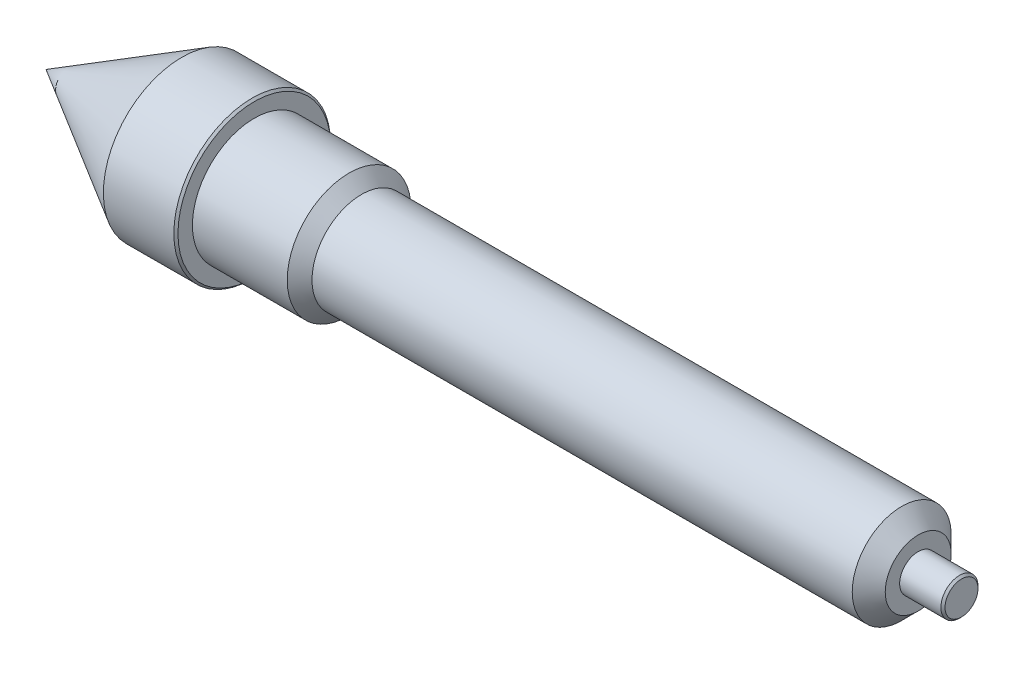
from build123d import *

# Parameters (mm, degrees)
SZKIC5_R                    = 4.5
DODANIE_WYCI_GNI_CIE4_DEPTH = 10.5
SFAZOWANIE1_SIZE            = 0.5
SZKIC6_R                    = 12
DODANIE_WYCI_GNI_CIE5_DEPTH = 135
SFAZOWANIE2_SIZE            = 4
SZKIC7_R                    = 15
DODANIE_WYCI_GNI_CIE6_DEPTH = 26
SFAZOWANIE4_SIZE            = 3
SZKIC8_R                    = 19
DODANIE_WYCI_GNI_CIE7_DEPTH = 17.59
SFAZOWANIE5_SIZE            = 0.5


with BuildPart() as part:
    # Szkic5 → Dodanie-wyciągnięcie4 (new body)
    with BuildSketch(Plane(origin=(0, 0, 0), x_dir=(0, 0, -1), z_dir=(1, 0, 0))):
        with Locations(Location((0, 0, 0), (0, 0, 180))):
            Circle(SZKIC5_R)
    extrude(amount=DODANIE_WYCI_GNI_CIE4_DEPTH)

    # Sfazowanie1
    sfazowanie1_edges = [part.edges().sort_by_distance(p)[0] for p in [
        (10.5, 0, -4.5),
    ]]
    chamfer(sfazowanie1_edges, length=SFAZOWANIE1_SIZE)

    # Szkic6 → Dodanie-wyciągnięcie5 (add)
    with BuildSketch(Plane.ZY):
        Circle(SZKIC6_R)
    extrude(amount=DODANIE_WYCI_GNI_CIE5_DEPTH)

    # Sfazowanie2
    sfazowanie2_edges = [part.edges().sort_by_distance(p)[0] for p in [
        (0, 0, -12),
    ]]
    chamfer(sfazowanie2_edges, length=SFAZOWANIE2_SIZE)

    # Szkic7 → Dodanie-wyciągnięcie6 (add)
    with BuildSketch(Plane.ZY.offset(135)):
        with Locations(Location((0, 0, 0), (0, 0, 180))):
            Circle(SZKIC7_R)
    extrude(amount=DODANIE_WYCI_GNI_CIE6_DEPTH)

    # Sfazowanie4
    sfazowanie4_edges = [part.edges().sort_by_distance(p)[0] for p in [
        (-135, 0, 15),
    ]]
    chamfer(sfazowanie4_edges, length=SFAZOWANIE4_SIZE - 0.0001)  # a hair under: the kernel refuses the full size

    # Szkic8 → Dodanie-wyciągnięcie7 (add)
    with BuildSketch(Plane.ZY.offset(161)):
        with Locations(Location((0, 0, 0), (0, 0, 180))):
            Circle(SZKIC8_R)
    extrude(amount=DODANIE_WYCI_GNI_CIE7_DEPTH)

    # Szkic10 → Obrót1 (revolve)
    with BuildSketch(Plane.XY):
        Polygon((-211.498965344, 0), (-178.59, 19), (-178.59, 0), align=None)
    revolve(axis=Axis((-178.59, 0, 0), (-1, 0, 0)))

    # Sfazowanie5
    sfazowanie5_edges = [part.edges().sort_by_distance(p)[0] for p in [
        (-161, 0, 19),
    ]]
    chamfer(sfazowanie5_edges, length=SFAZOWANIE5_SIZE)


solid = part.part
